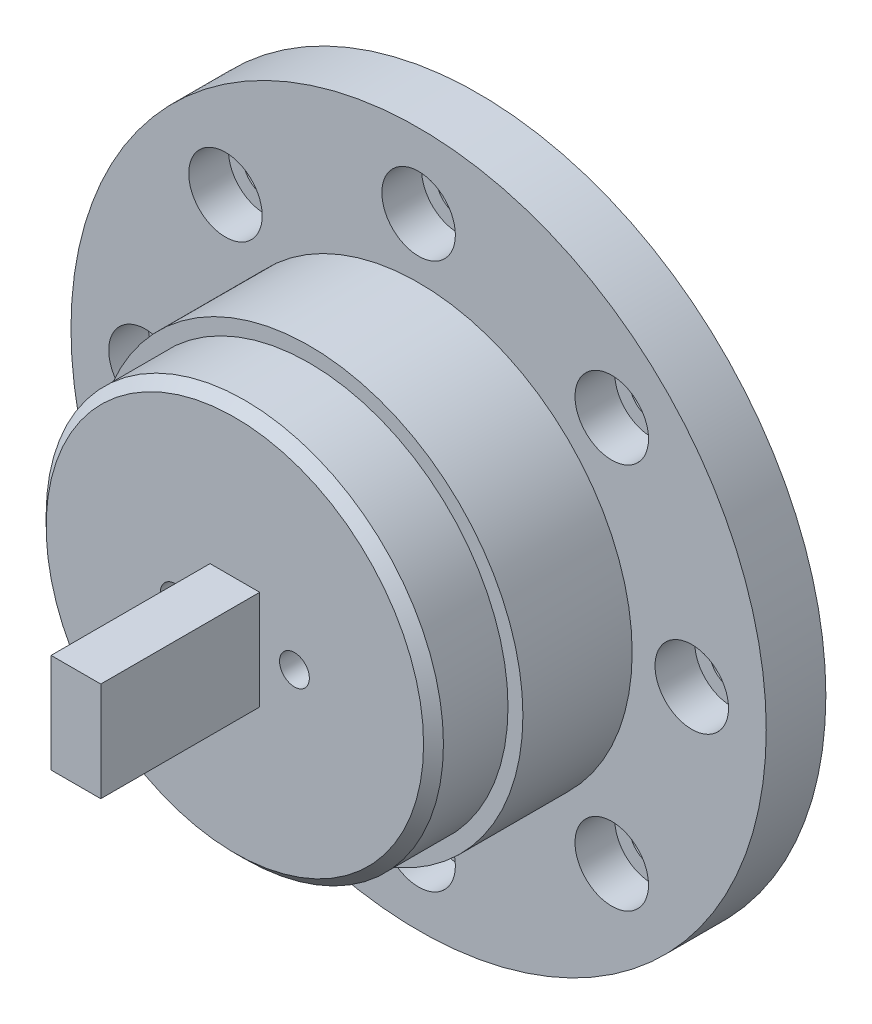
from build123d import *

# Parameters (mm, degrees)
SKETCH1_R           = 35
SKETCH1_R_2         = 2.2
BOSS_EXTRUDE1_DEPTH = 2
SKETCH2_R           = 35
SKETCH2_R_2         = 3.7
BOSS_EXTRUDE2_DEPTH = 4
SKETCH4_R           = 20
BOSS_EXTRUDE3_DEPTH = 18.5
SKETCH6_W           = 5
SKETCH6_H           = 10
BOSS_EXTRUDE4_DEPTH = 16
SKETCH7_R           = 21.5
BOSS_EXTRUDE5_DEPTH = 11
SKETCH5_R           = 1.5
CUT_EXTRUDE1_DEPTH  = 56.229068433
CHAMFER1_SIZE       = 1


with BuildPart() as part:
    # Sketch1 → Boss-Extrude1 (new body)
    with BuildSketch(Plane.XY):
        Circle(SKETCH1_R)
        with Locations((0, 27.5)):
            Circle(SKETCH1_R_2, mode=Mode.SUBTRACT)
        with Locations((19.445436483, 19.445436483)):
            Circle(SKETCH1_R_2, mode=Mode.SUBTRACT)
        with Locations((27.5, 0)):
            Circle(SKETCH1_R_2, mode=Mode.SUBTRACT)
        with Locations((19.445436483, -19.445436483)):
            Circle(SKETCH1_R_2, mode=Mode.SUBTRACT)
        with Locations((0, -27.5)):
            Circle(SKETCH1_R_2, mode=Mode.SUBTRACT)
        with Locations((-19.445436483, -19.445436483)):
            Circle(SKETCH1_R_2, mode=Mode.SUBTRACT)
        with Locations((-27.5, 0)):
            Circle(SKETCH1_R_2, mode=Mode.SUBTRACT)
        with Locations((-19.445436483, 19.445436483)):
            Circle(SKETCH1_R_2, mode=Mode.SUBTRACT)
    extrude(amount=BOSS_EXTRUDE1_DEPTH)

    # Sketch2 → Boss-Extrude2 (add)
    with BuildSketch(Plane.XY.offset(2)):
        Circle(SKETCH2_R)
        with Locations((-19.445436483, -19.445436483)):
            Circle(SKETCH2_R_2, mode=Mode.SUBTRACT)
        with Locations((-27.5, 0)):
            Circle(SKETCH2_R_2, mode=Mode.SUBTRACT)
        with Locations((0, -27.5)):
            Circle(SKETCH2_R_2, mode=Mode.SUBTRACT)
        with Locations((19.445436483, -19.445436483)):
            Circle(SKETCH2_R_2, mode=Mode.SUBTRACT)
        with Locations((-19.445436483, 19.445436483)):
            Circle(SKETCH2_R_2, mode=Mode.SUBTRACT)
        with Locations((27.5, 0)):
            Circle(SKETCH2_R_2, mode=Mode.SUBTRACT)
        with Locations((0, 27.5)):
            Circle(SKETCH2_R_2, mode=Mode.SUBTRACT)
        with Locations((19.445436483, 19.445436483)):
            Circle(SKETCH2_R_2, mode=Mode.SUBTRACT)
    extrude(amount=BOSS_EXTRUDE2_DEPTH)

    # Sketch4 → Boss-Extrude3 (add)
    with BuildSketch(Plane.XY.offset(6)):
        Circle(SKETCH4_R)
    extrude(amount=BOSS_EXTRUDE3_DEPTH)

    # Sketch6 → Boss-Extrude4 (add)
    with BuildSketch(Plane.XY.offset(24.5)):
        Rectangle(SKETCH6_W, SKETCH6_H)
    extrude(amount=BOSS_EXTRUDE4_DEPTH)

    # Sketch7 → Boss-Extrude5 (add)
    with BuildSketch(Plane.XY.offset(6)):
        Circle(SKETCH7_R)
    extrude(amount=BOSS_EXTRUDE5_DEPTH)

    # Sketch5 → Cut-Extrude1 (cut, through all)
    with BuildSketch(Plane.XY.offset(24.5)):
        with Locations((-6, 0)):
            Circle(SKETCH5_R)
        with Locations((6, 0)):
            Circle(SKETCH5_R)
    extrude(amount=-CUT_EXTRUDE1_DEPTH, mode=Mode.SUBTRACT)

    # Chamfer1
    chamfer1_edges = [part.edges().sort_by_distance(p)[0] for p in [
        (-20, 0, 24.5),
    ]]
    chamfer(chamfer1_edges, length=CHAMFER1_SIZE)


solid = part.part
